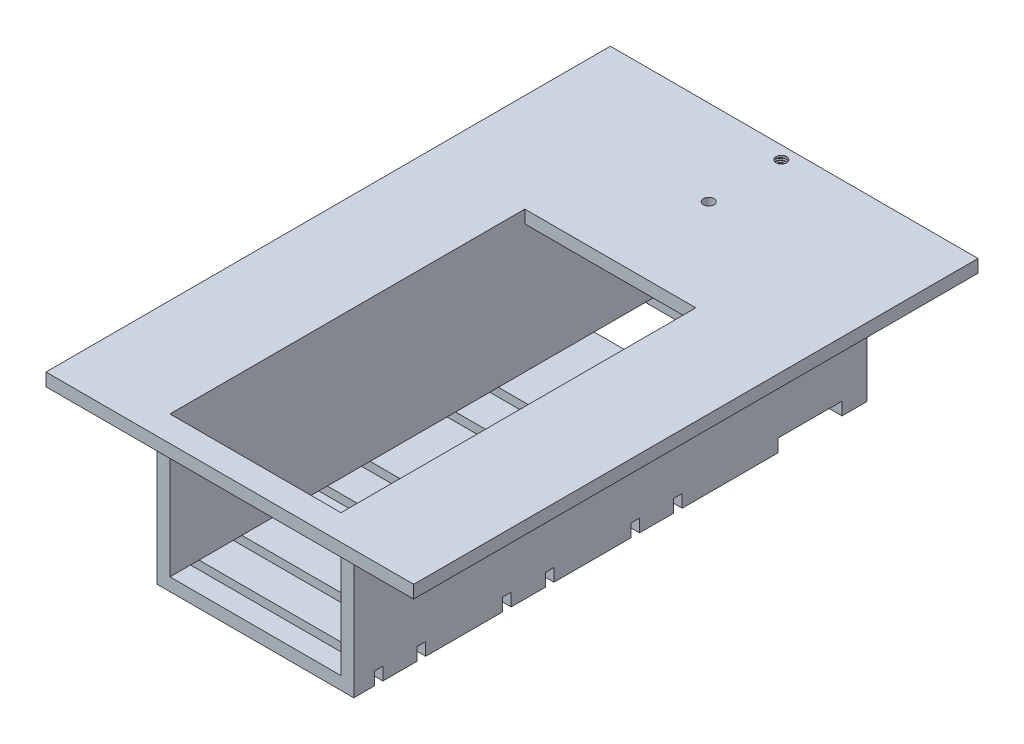
from build123d import *

# Parameters (mm, degrees)
BOSS_EXTRUDE1_DEPTH = 120
BOSS_EXTRUDE2_DEPTH = 1
SKETCH24_R          = 1.2500000000000002
BOSS_EXTRUDE5_DEPTH = 3
THREAD2_PITCH       = 0.5
SKETCH27_W          = 86
SKETCH27_H          = 6
BOSS_EXTRUDE6_DEPTH = 3
SKETCH28_R          = 1.250000000000001
BOSS_EXTRUDE7_DEPTH = 3
SKETCH29_W          = 46
SKETCH29_H          = 2
SKETCH29_H_2        = 2.000000000000014
SKETCH29_H_3        = 2.0000000000000284
CUT_EXTRUDE1_DEPTH  = 3


with BuildPart() as part:
    # Sketch1 → Boss-Extrude1 (new body)
    with BuildSketch(Plane.XY):
        Polygon((0, 0), (23, 0), (23, 33), (43, 33), (43, 36.00000000000001), (20, 36.00000000000001), (20.000000000000004, 2.9999999999999973), (-19.999999999999996, 2.9999999999999973), (-20, 36.000000000000014), (-43, 36.000000000000014), (-43, 33.00000000000001), (-23, 33), (-23, -2.82e-15), align=None)
    extrude(amount=BOSS_EXTRUDE1_DEPTH)

    # Sketch2 → Boss-Extrude2 (add)
    with BuildSketch(Plane.XY):
        Polygon((-20, 36.000000000000014), (20, 36.000000000000014), (20.000000000000004, 2.9999999999999973), (-19.999999999999996, 2.9999999999999973), align=None)
    extrude(amount=BOSS_EXTRUDE2_DEPTH)

    # Sketch24 → Boss-Extrude5 (add)
    # profile 1 of 2: a face of its own
    with BuildSketch(Plane(origin=(0, 36.000000000000014, 0), x_dir=(1, 0, 0), z_dir=(0, 1, 0))):
        Polygon((-43.000000000000014, 6), (-43, 0), (43, 0), (43, 6.000000000000011), align=None)
        with Locations(Location((0, 3, 0), (0, 0, 270))):
            Circle(SKETCH24_R, mode=Mode.SUBTRACT)
    # profile 2 of 2: a face of its own
    with BuildSketch(Plane(origin=(0, 36.000000000000014, 0), x_dir=(1, 0, 0), z_dir=(0, 1, 0))):
        Polygon((43, 0), (-43, 0), (-43, -120), (-20, -120), (-20, -1), (20, -1.0000000000000009), (20, -120), (43, -120), align=None)
    extrude(amount=-BOSS_EXTRUDE5_DEPTH)

    # Thread2: the profile of 螺纹线轮廓4 profile screwed along a right-hand helix of 6 turns, 6 arcs to a turn; built about Z, then put on its axis
    thread2_z = Axis((0, 0, 0), (0, 0, 1))
    thread2_corners = [(1.2497, 0, -0.000173205), (1.520632938, 0, 0.156249999), (1.520632938, 0, 0.218749999), (1.2497, 0, 0.375173204)]
    with BuildLine(mode=Mode.PRIVATE) as thread2_profile:
        Line(thread2_corners[0], thread2_corners[1])
        Line(thread2_corners[1], thread2_corners[2])
        Line(thread2_corners[2], thread2_corners[3])
        Line(thread2_corners[3], thread2_corners[0])
    thread2_cap = Face(thread2_profile.wire())
    thread2_turn_angles = [0, 30, 60, 90, 120, 150, 180, 210, 240, 270, 300, 330, 360]
    thread2_turn_weights = [1, 0.8660254037844387, 1, 0.8660254037844387, 1, 0.8660254037844387, 1, 0.8660254037844387, 1, 0.8660254037844387, 1, 0.8660254037844387, 1]
    thread2_turn_rails = [Edge.make_bspline([Vector(p[0], p[1], 0).rotate(thread2_z, thread2_turn_angles[k]) / thread2_turn_weights[k] + Vector(0, 0, p[2] + THREAD2_PITCH * thread2_turn_angles[k] / 360) for k in range(13)], [0, 0, 0, 1, 1, 2, 2, 3, 3, 4, 4, 5, 5, 6, 6, 6], 2, thread2_turn_weights) for p in thread2_corners]
    thread2_turn_sides = [Face.make_surface_from_curves(thread2_turn_rails[p[0]], thread2_turn_rails[p[1]]) for p in [(0, 1), (1, 2), (2, 3), (3, 0)]]
    thread2 = Plane(origin=(0, 36, -3), x_dir=(-1, 0, 0), z_dir=(0, -1, 0)) * Solid(Shell([*[p.moved(Location((0, 0, THREAD2_PITCH * i))) for i in range(6) for p in thread2_turn_sides], thread2_cap, thread2_cap.rotate(thread2_z, 2160).moved(Location((0, 0, THREAD2_PITCH * 2160 / 360)))]))
    add(thread2, mode=Mode.SUBTRACT)

    # Sketch27 → Boss-Extrude6 (add)
    with BuildSketch(Plane(origin=(0, 36.000000000000014, 0), x_dir=(1, 0, 0), z_dir=(0, 1, 0))):
        with Locations((-3.55e-15, -123.00000000000001)):
            Rectangle(SKETCH27_W, SKETCH27_H)
    extrude(amount=-BOSS_EXTRUDE6_DEPTH)

    # Sketch28 → Boss-Extrude7 (add)
    with BuildSketch(Plane(origin=(0, 36.000000000000014, 0), x_dir=(1, 0, 0), z_dir=(0, 1, 0))):
        Polygon((-19.999999999999996, -1.0000000000000009), (20.000000000000004, -1.0000000000000009), (20.000000000000004, -37.00000000000001), (-19.99999999999999, -37), align=None)
        with Locations(Location((0, -14.000000000000002, 0), (0, 0, 270))):
            Circle(SKETCH28_R, mode=Mode.SUBTRACT)
    extrude(amount=-BOSS_EXTRUDE7_DEPTH)

    # Sketch29 → Cut-Extrude1 (cut)
    with BuildSketch(Plane(origin=(0, 0, 0), x_dir=(-1, 0, 0), z_dir=(0, -1, 0))):
        Polygon((-23, -5.798088818556618), (23, -5.798088818556618), (23, -20.798088818556618), (-22.999999999999996, -20.798088818556618), align=None)
        with Locations((0, -44.19328812281581)):
            Rectangle(SKETCH29_W, SKETCH29_H)
        with Locations((1.0303e-13, -54.193288122815815)):
            Rectangle(SKETCH29_W, SKETCH29_H_2)
        with Locations((3.1264e-13, -74.19328812281582)):
            Rectangle(SKETCH29_W, SKETCH29_H)
        with Locations((4.1567e-13, -84.19328812281582)):
            Rectangle(SKETCH29_W, SKETCH29_H)
        with Locations((6.2528e-13, -104.19328812281582)):
            Rectangle(SKETCH29_W, SKETCH29_H_3)
        with Locations((7.2831e-13, -114.19328812281583)):
            Rectangle(SKETCH29_W, SKETCH29_H)
    extrude(amount=-CUT_EXTRUDE1_DEPTH, mode=Mode.SUBTRACT)


solid = part.part
